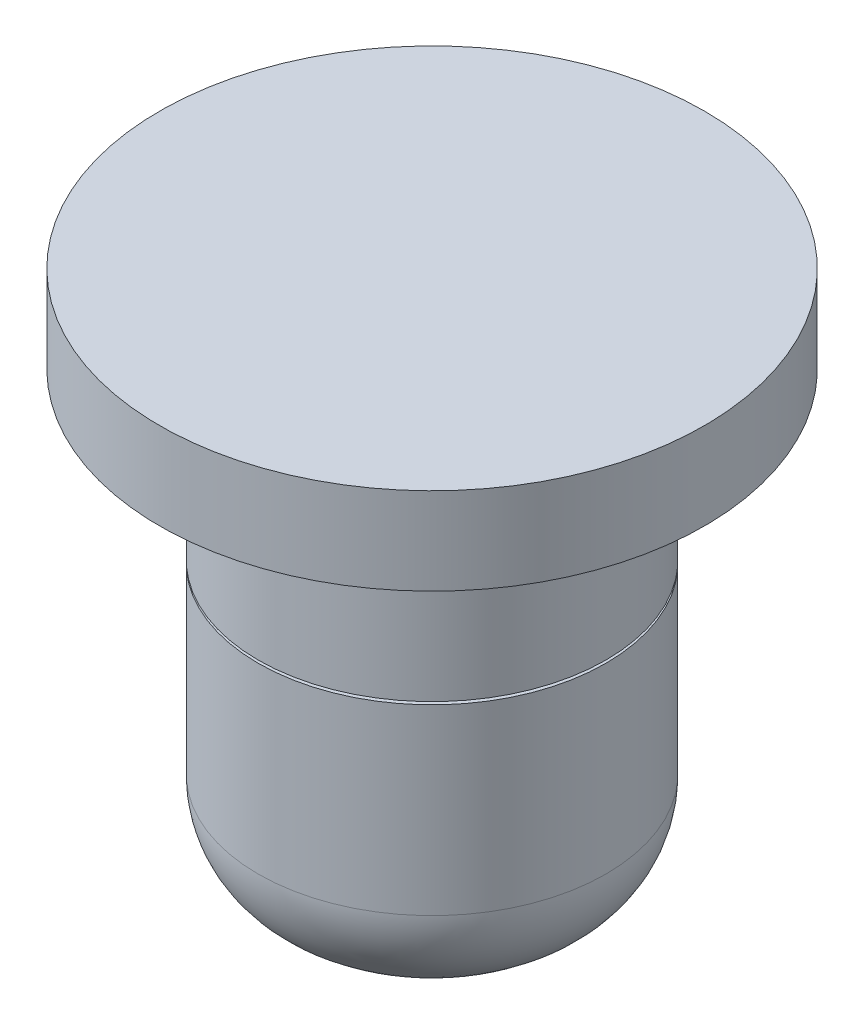
from build123d import *

# Parameters (mm, degrees)
CUT_EXTRUDE1_DEPTH      = 36.083710153
CUT_EXTRUDE1_DEPTH_BACK = 36.083710153
SKETCH2_W               = 72.831256038
SKETCH2_H               = 0.2


with BuildPart() as part:
    # Sketch1 → Revolve1 (revolve)
    with BuildSketch(Plane.XY):
        with BuildLine():
            Line((0, 18.626666667), (19.896666667, 18.626666667))
            Line((19.896666667, 18.626666667), (19.896666667, 12.276666667))
            Line((19.896666667, 12.276666667), (12.7, 12.276666667))
            Line((12.7, 12.276666667), (12.7, -13.335))
            ThreePointArc((12.7, -13.335), (10.468153673, -18.723153673), (5.08, -20.955))
            Line((5.08, -20.955), (0, -20.955))
            Line((0, -20.955), (0, 18.626666667))
        make_face()
    revolve(axis=Axis((0, -20.955, 0), (0, 1, 0)))

    # Sketch2 → Cut-Extrude1 (cut, two sides: drawn at the far end of the back side and taken through both)
    with BuildSketch(Plane.XY.offset(-CUT_EXTRUDE1_DEPTH_BACK)):
        with Locations((0, 0.1)):
            Rectangle(SKETCH2_W, SKETCH2_H)
    extrude(amount=CUT_EXTRUDE1_DEPTH + CUT_EXTRUDE1_DEPTH_BACK, mode=Mode.SUBTRACT)


with BuildPart() as cut_extrude1_piece_1:
    # of the separate pieces the step leaves, piece 1, a body of its own (cut_extrude1_pieces)
    add(part.part.solids().sort_by_distance((12.7, 12.276666667, 0))[0])


with BuildPart() as cut_extrude1_piece_2:
    # of the separate pieces the step leaves, piece 2, a body of its own (cut_extrude1_pieces)
    add(part.part.solids().sort_by_distance((5.08, -20.955, 0))[0])


solid = Compound([cut_extrude1_piece_1.part, cut_extrude1_piece_2.part])
